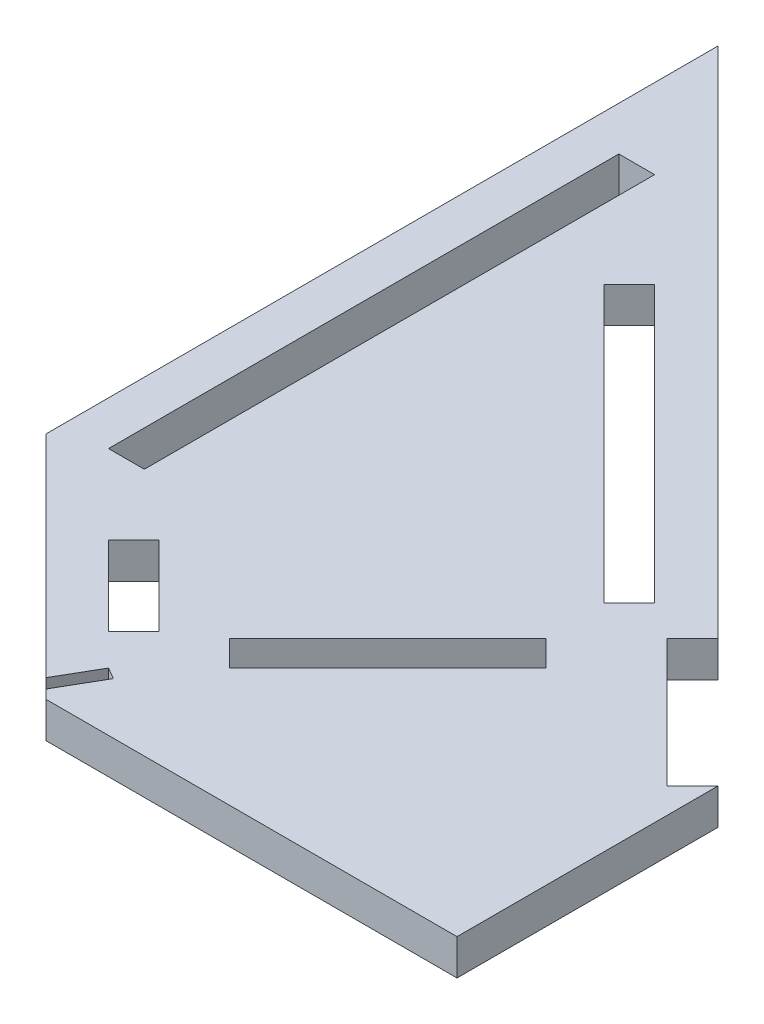
from build123d import *

# Parameters (mm, degrees)
SKETCH1_W           = 8
SKETCH1_H           = 113.93
BOSS_EXTRUDE1_DEPTH = 8


with BuildPart() as part:
    # Sketch1 → Boss-Extrude1 (new body)
    with BuildSketch(Plane(origin=(0, 0, 0), x_dir=(1, 0, 0), z_dir=(0, 1, 0))):
        Polygon((-91.75, 0), (0, 0), (0, 58.25), (-143.078881246, 201.328881246), (-143.078881246, 51.328881246), (-95.946152423, 4.196152423), (-90.845299381, 13.031089053), (-88.24722317, 11.531089053), (-93.75, 2), align=None)
        Polygon((-97.916366951, 20.102157284), (-115.594036481, 37.779826814), (-109.937182231, 43.436681063), (-92.259512701, 25.759011533), align=None, mode=Mode.SUBTRACT)
        Polygon((-77.336024326, 26.540364108), (-82.992878576, 32.197218357), (-47.637539517, 67.552557416), (-41.980685267, 61.895703167), align=None, mode=Mode.SUBTRACT)
        with Locations((-129.271706252, 112.422495924)):
            Rectangle(SKETCH1_W, SKETCH1_H, mode=Mode.SUBTRACT)
        Polygon((-48.083930018, 80.886011191), (-109.715357066, 142.517438239), (-104.058502817, 148.174292489), (-42.427075768, 86.54286544), align=None, mode=Mode.SUBTRACT)
        Polygon((-5.660145451, 52.59371346), (-34.128264462, 81.061832471), (-28.471410213, 86.71868672), (-0.003291202, 58.25056771), align=None, mode=Mode.SUBTRACT)
    extrude(amount=BOSS_EXTRUDE1_DEPTH)


solid = part.part
